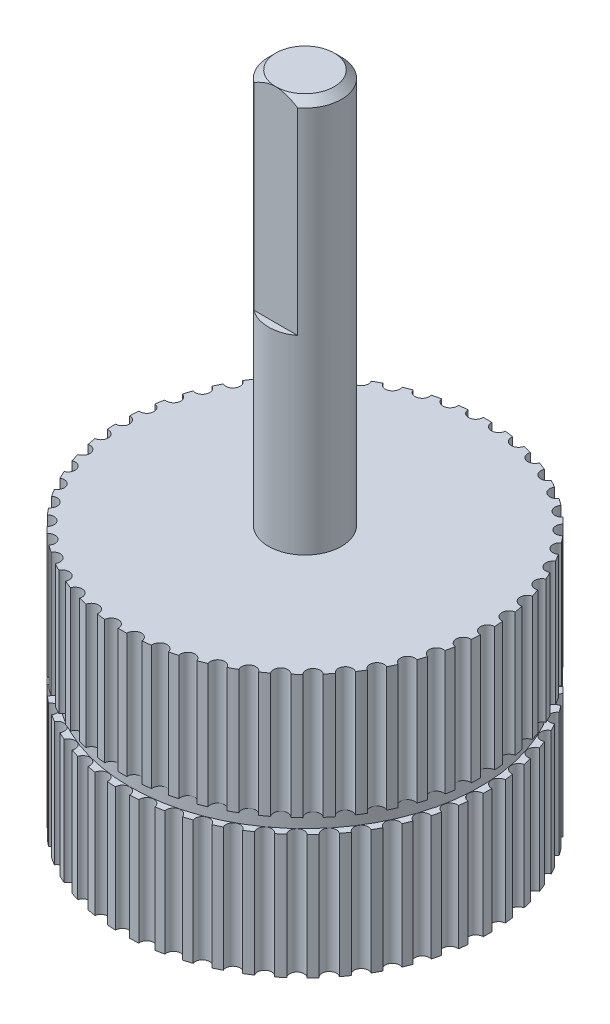
from build123d import *

# Parameters (mm, degrees)
SKETCH1_R             = 2.5
BOSS_EXTRUDE1_DEPTH   = 51
CHAMFER1_SIZE         = 0.5
CUT_EXTRUDE1_START    = -14
CUT_EXTRUDE1_DEPTH    = 14
BOSS_EXTRUDE2_START   = -6
BOSS_EXTRUDE2_DEPTH   = 8.5
SKETCH4_R             = 12
BOSS_EXTRUDE3_DEPTH   = 1
BOSS_EXTRUDE4_START   = -15.5
BOSS_EXTRUDE4_DEPTH   = 8.5
BODY_MOVE_COPY1_ANGLE = 3.6


with BuildPart() as part:
    # Sketch1 → Boss-Extrude1 (new body)
    with BuildSketch(Plane(origin=(0, 0, 0), x_dir=(1, 0, 0), z_dir=(0, 1, 0))):
        Circle(SKETCH1_R)
    extrude(amount=BOSS_EXTRUDE1_DEPTH)

    # Chamfer1
    chamfer1_edges = [part.edges().sort_by_distance(p)[0] for p in [
        (-2.5, 0, 0),
        (-2.5, 51, 0),
    ]]
    chamfer(chamfer1_edges, length=CHAMFER1_SIZE)

    # Sketch2 → Cut-Extrude1 (cut)
    with BuildSketch(Plane(origin=(0, 51, 0), x_dir=(1, 0, 0), z_dir=(0, 1, 0)).offset(CUT_EXTRUDE1_START)):
        with BuildLine():
            Line((-1.5, -2), (1.5, -2))
            ThreePointArc((1.5, -2), (0, -2.5), (-1.5, -2))
        make_face()
    extrude(amount=CUT_EXTRUDE1_DEPTH, mode=Mode.SUBTRACT)

    # Sketch3 → Boss-Extrude2 (add)
    with BuildSketch(Plane.XZ.offset(BOSS_EXTRUDE2_START)):
        with BuildLine():
            ThreePointArc((1.078579572, 12.453379706), (0.784881494, 12.475334105), (0.490747697, 12.490362953))
            ThreePointArc((0.490747697, 12.490362953), (0, 12.009157688), (-0.490747697, 12.490362953))
            ThreePointArc((-0.490747697, 12.490362953), (-0.784881494, 12.475334105), (-1.078579572, 12.453379706))
            ThreePointArc((-1.078579572, 12.453379706), (-1.505146565, 11.914461893), (-2.052335582, 12.330365715))
            ThreePointArc((-2.052335582, 12.330365715), (-2.342266432, 12.278590634), (-2.630896998, 12.219999222))
            ThreePointArc((-2.630896998, 12.219999222), (-2.98655607, 11.631867916), (-3.581556909, 11.975911243))
            ThreePointArc((-3.581556909, 11.975911243), (-3.86271243, 11.888206454), (-4.141723606, 11.79390205))
            ThreePointArc((-4.141723606, 11.79390205), (-4.420865802, 11.165832434), (-5.054294944, 11.432589497))
            ThreePointArc((-5.054294944, 11.432589497), (-5.322241145, 11.310338156), (-5.587232758, 11.181807998))
            ThreePointArc((-5.587232758, 11.181807998), (-5.785455839, 10.523705104), (-6.447323729, 10.708968986))
            ThreePointArc((-6.447323729, 10.708968986), (-6.697834937, 10.554099069), (-6.944627913, 10.393370154))
            ThreePointArc((-6.944627913, 10.393370154), (-7.058805782, 9.715612658), (-7.738674366, 9.816461636))
            ThreePointArc((-7.738674366, 9.816461636), (-7.967799872, 9.631415535), (-8.192502136, 9.441022654))
            ThreePointArc((-8.192502136, 9.441022654), (-8.22083414, 8.754299197), (-8.907981487, 8.769142822))
            ThreePointArc((-8.907981487, 8.769142822), (-9.112107843, 8.556838824), (-9.311175707, 8.339784586))
            ThreePointArc((-9.311175707, 8.339784586), (-9.253215034, 7.654925207), (-9.936804417, 7.583529388))
            ThreePointArc((-9.936804417, 7.583529388), (-10.11271243, 7.347315654), (-10.283006475, 7.107023134))
            ThreePointArc((-10.283006475, 7.107023134), (-10.139667198, 6.434828475), (-10.808918007, 6.278319164))
            ThreePointArc((-10.808918007, 6.278319164), (-10.953833501, 6.021920926), (-11.092668088, 5.762179682))
            ThreePointArc((-11.092668088, 5.762179682), (-10.866210754, 5.113250653), (-11.510568502, 4.874096097))
            ThreePointArc((-11.510568502, 4.874096097), (-11.622206074, 4.601556909), (-11.727391699, 4.326463213))
            ThreePointArc((-11.727391699, 4.326463213), (-11.421387675, 3.711033814), (-12.030690456, 3.393005623))
            ThreePointArc((-12.030690456, 3.393005623), (-12.107289514, 3.10862359), (-12.177167337, 2.822515836))
            ThreePointArc((-12.177167337, 2.822515836), (-11.796442489, 2.250291755), (-12.361081234, 1.858405424))
            ThreePointArc((-12.361081234, 1.858405424), (-12.401433766, 1.56666542), (-12.434901772, 1.274055697))
            ThreePointArc((-12.434901772, 1.274055697), (-11.985460359, 0.75406125), (-12.496530378, 0.29449706))
            ThreePointArc((-12.496530378, 0.29449706), (-12.5, 0), (-12.496530378, -0.29449706))
            ThreePointArc((-12.496530378, -0.29449706), (-11.985460359, -0.75406125), (-12.434901772, -1.274055697))
            ThreePointArc((-12.434901772, -1.274055697), (-12.401433766, -1.56666542), (-12.361081234, -1.858405424))
            ThreePointArc((-12.361081234, -1.858405424), (-11.796442489, -2.250291755), (-12.177167337, -2.822515836))
            ThreePointArc((-12.177167337, -2.822515836), (-12.107289514, -3.10862359), (-12.030690456, -3.393005623))
            ThreePointArc((-12.030690456, -3.393005623), (-11.421387675, -3.711033814), (-11.727391699, -4.326463213))
            ThreePointArc((-11.727391699, -4.326463213), (-11.622206074, -4.601556909), (-11.510568502, -4.874096097))
            ThreePointArc((-11.510568502, -4.874096097), (-10.866210754, -5.113250653), (-11.092668088, -5.762179682))
            ThreePointArc((-11.092668088, -5.762179682), (-10.953833501, -6.021920926), (-10.808918007, -6.278319164))
            ThreePointArc((-10.808918007, -6.278319164), (-10.139667198, -6.434828475), (-10.283006475, -7.107023134))
            ThreePointArc((-10.283006475, -7.107023134), (-10.11271243, -7.347315654), (-9.936804417, -7.583529388))
            ThreePointArc((-9.936804417, -7.583529388), (-9.253215034, -7.654925207), (-9.311175707, -8.339784586))
            ThreePointArc((-9.311175707, -8.339784586), (-9.112107843, -8.556838824), (-8.907981487, -8.769142822))
            ThreePointArc((-8.907981487, -8.769142822), (-8.22083414, -8.754299197), (-8.192502136, -9.441022654))
            ThreePointArc((-8.192502136, -9.441022654), (-7.967799872, -9.631415535), (-7.738674366, -9.816461636))
            ThreePointArc((-7.738674366, -9.816461636), (-7.058805782, -9.715612658), (-6.944627913, -10.393370154))
            ThreePointArc((-6.944627913, -10.393370154), (-6.697834937, -10.554099069), (-6.447323729, -10.708968986))
            ThreePointArc((-6.447323729, -10.708968986), (-5.785455839, -10.523705104), (-5.587232758, -11.181807998))
            ThreePointArc((-5.587232758, -11.181807998), (-5.322241145, -11.310338156), (-5.054294944, -11.432589497))
            ThreePointArc((-5.054294944, -11.432589497), (-4.420865802, -11.165832434), (-4.141723606, -11.79390205))
            ThreePointArc((-4.141723606, -11.79390205), (-3.86271243, -11.888206454), (-3.581556909, -11.975911243))
            ThreePointArc((-3.581556909, -11.975911243), (-2.98655607, -11.631867916), (-2.630896998, -12.219999222))
            ThreePointArc((-2.630896998, -12.219999222), (-2.342266432, -12.278590634), (-2.052335582, -12.330365715))
            ThreePointArc((-2.052335582, -12.330365715), (-1.505146565, -11.914461893), (-1.078579572, -12.453379706))
            ThreePointArc((-1.078579572, -12.453379706), (-0.784881494, -12.475334105), (-0.490747697, -12.490362953))
            ThreePointArc((-0.490747697, -12.490362953), (0, -12.009157688), (0.490747697, -12.490362953))
            ThreePointArc((0.490747697, -12.490362953), (0.784881494, -12.475334105), (1.078579572, -12.453379706))
            ThreePointArc((1.078579572, -12.453379706), (1.505146565, -11.914461893), (2.052335582, -12.330365715))
            ThreePointArc((2.052335582, -12.330365715), (2.342266432, -12.278590634), (2.630896998, -12.219999222))
            ThreePointArc((2.630896998, -12.219999222), (2.98655607, -11.631867916), (3.581556909, -11.975911243))
            ThreePointArc((3.581556909, -11.975911243), (3.86271243, -11.888206454), (4.141723606, -11.79390205))
            ThreePointArc((4.141723606, -11.79390205), (4.420865802, -11.165832434), (5.054294944, -11.432589497))
            ThreePointArc((5.054294944, -11.432589497), (5.322241145, -11.310338156), (5.587232758, -11.181807998))
            ThreePointArc((5.587232758, -11.181807998), (5.785455839, -10.523705104), (6.447323729, -10.708968986))
            ThreePointArc((6.447323729, -10.708968986), (6.697834937, -10.554099069), (6.944627913, -10.393370154))
            ThreePointArc((6.944627913, -10.393370154), (7.058805782, -9.715612658), (7.738674366, -9.816461636))
            ThreePointArc((7.738674366, -9.816461636), (7.967799872, -9.631415535), (8.192502136, -9.441022654))
            ThreePointArc((8.192502136, -9.441022654), (8.22083414, -8.754299197), (8.907981487, -8.769142822))
            ThreePointArc((8.907981487, -8.769142822), (9.112107843, -8.556838824), (9.311175707, -8.339784586))
            ThreePointArc((9.311175707, -8.339784586), (9.253215034, -7.654925207), (9.936804417, -7.583529388))
            ThreePointArc((9.936804417, -7.583529388), (10.11271243, -7.347315654), (10.283006475, -7.107023134))
            ThreePointArc((10.283006475, -7.107023134), (10.139667198, -6.434828475), (10.808918007, -6.278319164))
            ThreePointArc((10.808918007, -6.278319164), (10.953833501, -6.021920926), (11.092668088, -5.762179682))
            ThreePointArc((11.092668088, -5.762179682), (10.866210754, -5.113250653), (11.510568502, -4.874096097))
            ThreePointArc((11.510568502, -4.874096097), (11.622206074, -4.601556909), (11.727391699, -4.326463213))
            ThreePointArc((11.727391699, -4.326463213), (11.421387675, -3.711033814), (12.030690456, -3.393005623))
            ThreePointArc((12.030690456, -3.393005623), (12.107289514, -3.10862359), (12.177167337, -2.822515836))
            ThreePointArc((12.177167337, -2.822515836), (11.796442489, -2.250291755), (12.361081234, -1.858405424))
            ThreePointArc((12.361081234, -1.858405424), (12.401433766, -1.56666542), (12.434901772, -1.274055697))
            ThreePointArc((12.434901772, -1.274055697), (11.985460359, -0.75406125), (12.496530378, -0.29449706))
            ThreePointArc((12.496530378, -0.29449706), (12.5, 0), (12.496530378, 0.29449706))
            ThreePointArc((12.496530378, 0.29449706), (11.985460359, 0.75406125), (12.434901772, 1.274055697))
            ThreePointArc((12.434901772, 1.274055697), (12.401433766, 1.56666542), (12.361081234, 1.858405424))
            ThreePointArc((12.361081234, 1.858405424), (11.796442489, 2.250291755), (12.177167337, 2.822515836))
            ThreePointArc((12.177167337, 2.822515836), (12.107289514, 3.10862359), (12.030690456, 3.393005623))
            ThreePointArc((12.030690456, 3.393005623), (11.421387675, 3.711033814), (11.727391699, 4.326463213))
            ThreePointArc((11.727391699, 4.326463213), (11.622206074, 4.601556909), (11.510568502, 4.874096097))
            ThreePointArc((11.510568502, 4.874096097), (10.866210754, 5.113250653), (11.092668088, 5.762179682))
            ThreePointArc((11.092668088, 5.762179682), (10.953833501, 6.021920926), (10.808918007, 6.278319164))
            ThreePointArc((10.808918007, 6.278319164), (10.139667198, 6.434828475), (10.283006475, 7.107023134))
            ThreePointArc((10.283006475, 7.107023134), (10.11271243, 7.347315654), (9.936804417, 7.583529388))
            ThreePointArc((9.936804417, 7.583529388), (9.253215034, 7.654925207), (9.311175707, 8.339784586))
            ThreePointArc((9.311175707, 8.339784586), (9.112107843, 8.556838824), (8.907981487, 8.769142822))
            ThreePointArc((8.907981487, 8.769142822), (8.22083414, 8.754299197), (8.192502136, 9.441022654))
            ThreePointArc((8.192502136, 9.441022654), (7.967799872, 9.631415535), (7.738674366, 9.816461636))
            ThreePointArc((7.738674366, 9.816461636), (7.058805782, 9.715612658), (6.944627913, 10.393370154))
            ThreePointArc((6.944627913, 10.393370154), (6.697834937, 10.554099069), (6.447323729, 10.708968986))
            ThreePointArc((6.447323729, 10.708968986), (5.785455839, 10.523705104), (5.587232758, 11.181807998))
            ThreePointArc((5.587232758, 11.181807998), (5.322241145, 11.310338156), (5.054294944, 11.432589497))
            ThreePointArc((5.054294944, 11.432589497), (4.420865802, 11.165832434), (4.141723606, 11.79390205))
            ThreePointArc((4.141723606, 11.79390205), (3.86271243, 11.888206454), (3.581556909, 11.975911243))
            ThreePointArc((3.581556909, 11.975911243), (2.98655607, 11.631867916), (2.630896998, 12.219999222))
            ThreePointArc((2.630896998, 12.219999222), (2.342266432, 12.278590634), (2.052335582, 12.330365715))
            ThreePointArc((2.052335582, 12.330365715), (1.505146565, 11.914461893), (1.078579572, 12.453379706))
        make_face()
    extrude(amount=-BOSS_EXTRUDE2_DEPTH)

    # Sketch4 → Boss-Extrude3 (add)
    with BuildSketch(Plane(origin=(0, 14.5, 0), x_dir=(1, 0, 0), z_dir=(0, 1, 0))):
        Circle(SKETCH4_R)
    extrude(amount=BOSS_EXTRUDE3_DEPTH)


with BuildPart() as body_2:
    # Sketch3<2> → Boss-Extrude4 (new body)
    with BuildSketch(Plane.XZ.offset(BOSS_EXTRUDE4_START)):
        with BuildLine():
            ThreePointArc((1.078579572, 12.453379706), (0.784881494, 12.475334105), (0.490747697, 12.490362953))
            ThreePointArc((0.490747697, 12.490362953), (0, 12.009157688), (-0.490747697, 12.490362953))
            ThreePointArc((-0.490747697, 12.490362953), (-0.784881494, 12.475334105), (-1.078579572, 12.453379706))
            ThreePointArc((-1.078579572, 12.453379706), (-1.505146565, 11.914461893), (-2.052335582, 12.330365715))
            ThreePointArc((-2.052335582, 12.330365715), (-2.342266432, 12.278590634), (-2.630896998, 12.219999222))
            ThreePointArc((-2.630896998, 12.219999222), (-2.98655607, 11.631867916), (-3.581556909, 11.975911243))
            ThreePointArc((-3.581556909, 11.975911243), (-3.86271243, 11.888206454), (-4.141723606, 11.79390205))
            ThreePointArc((-4.141723606, 11.79390205), (-4.420865802, 11.165832434), (-5.054294944, 11.432589497))
            ThreePointArc((-5.054294944, 11.432589497), (-5.322241145, 11.310338156), (-5.587232758, 11.181807998))
            ThreePointArc((-5.587232758, 11.181807998), (-5.785455839, 10.523705104), (-6.447323729, 10.708968986))
            ThreePointArc((-6.447323729, 10.708968986), (-6.697834937, 10.554099069), (-6.944627913, 10.393370154))
            ThreePointArc((-6.944627913, 10.393370154), (-7.058805782, 9.715612658), (-7.738674366, 9.816461636))
            ThreePointArc((-7.738674366, 9.816461636), (-7.967799872, 9.631415535), (-8.192502136, 9.441022654))
            ThreePointArc((-8.192502136, 9.441022654), (-8.22083414, 8.754299197), (-8.907981487, 8.769142822))
            ThreePointArc((-8.907981487, 8.769142822), (-9.112107843, 8.556838824), (-9.311175707, 8.339784586))
            ThreePointArc((-9.311175707, 8.339784586), (-9.253215034, 7.654925207), (-9.936804417, 7.583529388))
            ThreePointArc((-9.936804417, 7.583529388), (-10.11271243, 7.347315654), (-10.283006475, 7.107023134))
            ThreePointArc((-10.283006475, 7.107023134), (-10.139667198, 6.434828475), (-10.808918007, 6.278319164))
            ThreePointArc((-10.808918007, 6.278319164), (-10.953833501, 6.021920926), (-11.092668088, 5.762179682))
            ThreePointArc((-11.092668088, 5.762179682), (-10.866210754, 5.113250653), (-11.510568502, 4.874096097))
            ThreePointArc((-11.510568502, 4.874096097), (-11.622206074, 4.601556909), (-11.727391699, 4.326463213))
            ThreePointArc((-11.727391699, 4.326463213), (-11.421387675, 3.711033814), (-12.030690456, 3.393005623))
            ThreePointArc((-12.030690456, 3.393005623), (-12.107289514, 3.10862359), (-12.177167337, 2.822515836))
            ThreePointArc((-12.177167337, 2.822515836), (-11.796442489, 2.250291755), (-12.361081234, 1.858405424))
            ThreePointArc((-12.361081234, 1.858405424), (-12.401433766, 1.56666542), (-12.434901772, 1.274055697))
            ThreePointArc((-12.434901772, 1.274055697), (-11.985460359, 0.75406125), (-12.496530378, 0.29449706))
            ThreePointArc((-12.496530378, 0.29449706), (-12.5, 0), (-12.496530378, -0.29449706))
            ThreePointArc((-12.496530378, -0.29449706), (-11.985460359, -0.75406125), (-12.434901772, -1.274055697))
            ThreePointArc((-12.434901772, -1.274055697), (-12.401433766, -1.56666542), (-12.361081234, -1.858405424))
            ThreePointArc((-12.361081234, -1.858405424), (-11.796442489, -2.250291755), (-12.177167337, -2.822515836))
            ThreePointArc((-12.177167337, -2.822515836), (-12.107289514, -3.10862359), (-12.030690456, -3.393005623))
            ThreePointArc((-12.030690456, -3.393005623), (-11.421387675, -3.711033814), (-11.727391699, -4.326463213))
            ThreePointArc((-11.727391699, -4.326463213), (-11.622206074, -4.601556909), (-11.510568502, -4.874096097))
            ThreePointArc((-11.510568502, -4.874096097), (-10.866210754, -5.113250653), (-11.092668088, -5.762179682))
            ThreePointArc((-11.092668088, -5.762179682), (-10.953833501, -6.021920926), (-10.808918007, -6.278319164))
            ThreePointArc((-10.808918007, -6.278319164), (-10.139667198, -6.434828475), (-10.283006475, -7.107023134))
            ThreePointArc((-10.283006475, -7.107023134), (-10.11271243, -7.347315654), (-9.936804417, -7.583529388))
            ThreePointArc((-9.936804417, -7.583529388), (-9.253215034, -7.654925207), (-9.311175707, -8.339784586))
            ThreePointArc((-9.311175707, -8.339784586), (-9.112107843, -8.556838824), (-8.907981487, -8.769142822))
            ThreePointArc((-8.907981487, -8.769142822), (-8.22083414, -8.754299197), (-8.192502136, -9.441022654))
            ThreePointArc((-8.192502136, -9.441022654), (-7.967799872, -9.631415535), (-7.738674366, -9.816461636))
            ThreePointArc((-7.738674366, -9.816461636), (-7.058805782, -9.715612658), (-6.944627913, -10.393370154))
            ThreePointArc((-6.944627913, -10.393370154), (-6.697834937, -10.554099069), (-6.447323729, -10.708968986))
            ThreePointArc((-6.447323729, -10.708968986), (-5.785455839, -10.523705104), (-5.587232758, -11.181807998))
            ThreePointArc((-5.587232758, -11.181807998), (-5.322241145, -11.310338156), (-5.054294944, -11.432589497))
            ThreePointArc((-5.054294944, -11.432589497), (-4.420865802, -11.165832434), (-4.141723606, -11.79390205))
            ThreePointArc((-4.141723606, -11.79390205), (-3.86271243, -11.888206454), (-3.581556909, -11.975911243))
            ThreePointArc((-3.581556909, -11.975911243), (-2.98655607, -11.631867916), (-2.630896998, -12.219999222))
            ThreePointArc((-2.630896998, -12.219999222), (-2.342266432, -12.278590634), (-2.052335582, -12.330365715))
            ThreePointArc((-2.052335582, -12.330365715), (-1.505146565, -11.914461893), (-1.078579572, -12.453379706))
            ThreePointArc((-1.078579572, -12.453379706), (-0.784881494, -12.475334105), (-0.490747697, -12.490362953))
            ThreePointArc((-0.490747697, -12.490362953), (0, -12.009157688), (0.490747697, -12.490362953))
            ThreePointArc((0.490747697, -12.490362953), (0.784881494, -12.475334105), (1.078579572, -12.453379706))
            ThreePointArc((1.078579572, -12.453379706), (1.505146565, -11.914461893), (2.052335582, -12.330365715))
            ThreePointArc((2.052335582, -12.330365715), (2.342266432, -12.278590634), (2.630896998, -12.219999222))
            ThreePointArc((2.630896998, -12.219999222), (2.98655607, -11.631867916), (3.581556909, -11.975911243))
            ThreePointArc((3.581556909, -11.975911243), (3.86271243, -11.888206454), (4.141723606, -11.79390205))
            ThreePointArc((4.141723606, -11.79390205), (4.420865802, -11.165832434), (5.054294944, -11.432589497))
            ThreePointArc((5.054294944, -11.432589497), (5.322241145, -11.310338156), (5.587232758, -11.181807998))
            ThreePointArc((5.587232758, -11.181807998), (5.785455839, -10.523705104), (6.447323729, -10.708968986))
            ThreePointArc((6.447323729, -10.708968986), (6.697834937, -10.554099069), (6.944627913, -10.393370154))
            ThreePointArc((6.944627913, -10.393370154), (7.058805782, -9.715612658), (7.738674366, -9.816461636))
            ThreePointArc((7.738674366, -9.816461636), (7.967799872, -9.631415535), (8.192502136, -9.441022654))
            ThreePointArc((8.192502136, -9.441022654), (8.22083414, -8.754299197), (8.907981487, -8.769142822))
            ThreePointArc((8.907981487, -8.769142822), (9.112107843, -8.556838824), (9.311175707, -8.339784586))
            ThreePointArc((9.311175707, -8.339784586), (9.253215034, -7.654925207), (9.936804417, -7.583529388))
            ThreePointArc((9.936804417, -7.583529388), (10.11271243, -7.347315654), (10.283006475, -7.107023134))
            ThreePointArc((10.283006475, -7.107023134), (10.139667198, -6.434828475), (10.808918007, -6.278319164))
            ThreePointArc((10.808918007, -6.278319164), (10.953833501, -6.021920926), (11.092668088, -5.762179682))
            ThreePointArc((11.092668088, -5.762179682), (10.866210754, -5.113250653), (11.510568502, -4.874096097))
            ThreePointArc((11.510568502, -4.874096097), (11.622206074, -4.601556909), (11.727391699, -4.326463213))
            ThreePointArc((11.727391699, -4.326463213), (11.421387675, -3.711033814), (12.030690456, -3.393005623))
            ThreePointArc((12.030690456, -3.393005623), (12.107289514, -3.10862359), (12.177167337, -2.822515836))
            ThreePointArc((12.177167337, -2.822515836), (11.796442489, -2.250291755), (12.361081234, -1.858405424))
            ThreePointArc((12.361081234, -1.858405424), (12.401433766, -1.56666542), (12.434901772, -1.274055697))
            ThreePointArc((12.434901772, -1.274055697), (11.985460359, -0.75406125), (12.496530378, -0.29449706))
            ThreePointArc((12.496530378, -0.29449706), (12.5, 0), (12.496530378, 0.29449706))
            ThreePointArc((12.496530378, 0.29449706), (11.985460359, 0.75406125), (12.434901772, 1.274055697))
            ThreePointArc((12.434901772, 1.274055697), (12.401433766, 1.56666542), (12.361081234, 1.858405424))
            ThreePointArc((12.361081234, 1.858405424), (11.796442489, 2.250291755), (12.177167337, 2.822515836))
            ThreePointArc((12.177167337, 2.822515836), (12.107289514, 3.10862359), (12.030690456, 3.393005623))
            ThreePointArc((12.030690456, 3.393005623), (11.421387675, 3.711033814), (11.727391699, 4.326463213))
            ThreePointArc((11.727391699, 4.326463213), (11.622206074, 4.601556909), (11.510568502, 4.874096097))
            ThreePointArc((11.510568502, 4.874096097), (10.866210754, 5.113250653), (11.092668088, 5.762179682))
            ThreePointArc((11.092668088, 5.762179682), (10.953833501, 6.021920926), (10.808918007, 6.278319164))
            ThreePointArc((10.808918007, 6.278319164), (10.139667198, 6.434828475), (10.283006475, 7.107023134))
            ThreePointArc((10.283006475, 7.107023134), (10.11271243, 7.347315654), (9.936804417, 7.583529388))
            ThreePointArc((9.936804417, 7.583529388), (9.253215034, 7.654925207), (9.311175707, 8.339784586))
            ThreePointArc((9.311175707, 8.339784586), (9.112107843, 8.556838824), (8.907981487, 8.769142822))
            ThreePointArc((8.907981487, 8.769142822), (8.22083414, 8.754299197), (8.192502136, 9.441022654))
            ThreePointArc((8.192502136, 9.441022654), (7.967799872, 9.631415535), (7.738674366, 9.816461636))
            ThreePointArc((7.738674366, 9.816461636), (7.058805782, 9.715612658), (6.944627913, 10.393370154))
            ThreePointArc((6.944627913, 10.393370154), (6.697834937, 10.554099069), (6.447323729, 10.708968986))
            ThreePointArc((6.447323729, 10.708968986), (5.785455839, 10.523705104), (5.587232758, 11.181807998))
            ThreePointArc((5.587232758, 11.181807998), (5.322241145, 11.310338156), (5.054294944, 11.432589497))
            ThreePointArc((5.054294944, 11.432589497), (4.420865802, 11.165832434), (4.141723606, 11.79390205))
            ThreePointArc((4.141723606, 11.79390205), (3.86271243, 11.888206454), (3.581556909, 11.975911243))
            ThreePointArc((3.581556909, 11.975911243), (2.98655607, 11.631867916), (2.630896998, 12.219999222))
            ThreePointArc((2.630896998, 12.219999222), (2.342266432, 12.278590634), (2.052335582, 12.330365715))
            ThreePointArc((2.052335582, 12.330365715), (1.505146565, 11.914461893), (1.078579572, 12.453379706))
        make_face()
    extrude(amount=-BOSS_EXTRUDE4_DEPTH)


with BuildPart() as body_2_1:
    # Body-Move/Copy1: moved
    add(body_2.part.rotate(Axis((0, 0, 0), (0, 1, 0)), BODY_MOVE_COPY1_ANGLE))


with BuildPart() as part_1:
    add(part.part)

    # Combine1: union body 2
    add(body_2_1.part)


solid = part_1.part
